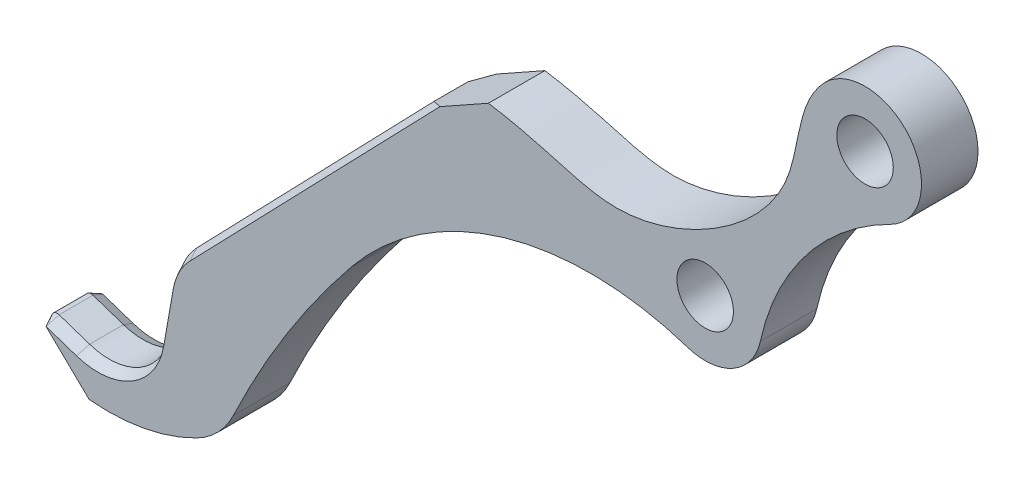
from build123d import *
from OCP.BRepFilletAPI import BRepFilletAPI_MakeChamfer

# Parameters (mm, degrees)
SKETCH_1_R          = 2.5
EXTRUDE_1_DEPTH     = 2.5
SKETCH_2_OUTSIDE_W  = 116.118
SKETCH_2_OUTSIDE_H  = 88.955
CUT_EXTRUDE_1_DEPTH = 5
CHAMFER_1_SIZE      = 1
CHAMFER_1_SIZE_2    = 0.5
CHAMFER_2_SIZE      = 0.5
CHAMFER_2_SIZE_2    = 1


with BuildPart() as part:
    # 草圖1 → 填料-伸長1 (new, symmetric)
    with BuildSketch(Plane.XY):
        with BuildLine():
            Line((33.210571119, 22.487406669), (9.212656684, 9.024071248))
            Line((9.212656684, 9.024071248), (9.212656684, 13.217540535))
            Line((9.212656684, 13.217540535), (-51.018500429, 13.217540535))
            Line((-51.018500429, 13.217540535), (-51.018500429, -41.386180002))
            Line((-51.018500429, -41.386180002), (9.212656684, -41.386180002))
            Line((9.212656684, -41.386180002), (9.212656684, -5))
            Line((9.212656684, -5), (21.5, -5))
            ThreePointArc((21.5, -5), (23.692257033, -4.493774483), (25.440603486, -3.07760364))
            Line((25.440603486, -3.07760364), (39.59758023, 15.049172396))
            ThreePointArc((39.59758023, 15.049172396), (39.450390654, 21.384077206), (33.210571119, 22.487406669))
        make_face()
        with Locations((21.5, 0)):
            Circle(SKETCH_1_R, mode=Mode.SUBTRACT)
        with Locations((35.656976744, 18.126776036)):
            Circle(SKETCH_1_R, mode=Mode.SUBTRACT)
    extrude(amount=EXTRUDE_1_DEPTH, both=True)

    # 草圖2 outside → 除料-伸長1 (cut)
    with BuildSketch(Plane.XY.offset(2.5)):
        with Locations((-5.181, -9.1295)):
            Rectangle(SKETCH_2_OUTSIDE_W, SKETCH_2_OUTSIDE_H)
        with BuildLine():
            Line((-3.504662874, 1.889387135), (-24.499095951, -19.837093245))
            ThreePointArc((-24.499095951, -19.837093245), (-25.530846828, -21.28330144), (-26.093887373, -22.968238639))
            Line((-26.093887373, -22.968238639), (-26.940110928, -27.785073774))
            ThreePointArc((-26.940110928, -27.785073774), (-29.508767127, -31.506192899), (-34.004940633, -31.984884889))
            Line((-34.004940633, -31.984884889), (-36.707285896, -31.076719678))
            ThreePointArc((-36.707285896, -31.076719678), (-37.293807717, -31.290934133), (-37.214008802, -31.910230356))
            Line((-37.214008802, -31.910230356), (-33.875603228, -35.136152419))
            ThreePointArc((-33.875603228, -35.136152419), (-28.5650672, -35.094081272), (-23.520676583, -33.433453021))
            ThreePointArc((-23.520676583, -33.433453021), (-21.623015625, -32.029319154), (-20.278640263, -30.088864592))
            ThreePointArc((-20.278640263, -30.088864592), (-15.559314436, -21.479893225), (-9.851228903, -13.492141112))
            ThreePointArc((-9.851228903, -13.492141112), (3.673898096, -4.470950273), (19.929199503, -4.746850092))
            ThreePointArc((19.929199503, -4.746850092), (23.974199209, -4.344920975), (26.383894798, -1.071247685))
            ThreePointArc((26.383894798, -1.071247685), (30.458421446, 7.595163953), (37.879524863, 13.647905658))
            ThreePointArc((37.879524863, 13.647905658), (39.697047859, 21.072590929), (32.072223107, 21.612395258))
            add(Edge.make_bspline(
                [(32.072223107, 21.612395258), (29.619553058, 19.089968877), (30.529442098, 9.384107467), (14.497116464, 0.221014353), (7.895302384, 4.290965143), (2.303499892, 5.147888773)],
                knots=[0, 0, 0, 0, 0.241565864, 0.691252681, 1, 1, 1, 1], degree=3))
            Line((2.303499892, 5.147888773), (-3.504662874, 1.889387135))
        make_face(mode=Mode.SUBTRACT)
    extrude(amount=-CUT_EXTRUDE_1_DEPTH, mode=Mode.SUBTRACT)

    # 導角1
    chamfer_1_edges_1 = [part.edges().sort_by_distance(p)[0] for p in [
        (-35.544806015, -33.523191388, 2.5),
    ]]
    chamfer_1_side_1 = [part.faces().sort_by_distance(p)[0] for p in [
        (-35.544806015, -33.523191388, 2.49),
    ]]
    chamfer_1_edges_2 = [part.edges().sort_by_distance(p)[0] for p in [
        (-37.293807717, -31.290934133, 2.5),
    ]]
    chamfer_1_side_2 = [part.faces().sort_by_distance(p)[0] for p in [
        (-37.293807717, -31.290934133, 2.49),
    ]]
    chamfer_1_edges_3 = [part.edges().sort_by_distance(p)[0] for p in [
        (-35.356113265, -31.530802283, 2.5),
    ]]
    chamfer_1_side_3 = [part.faces().sort_by_distance(p)[0] for p in [
        (-35.356113265, -31.530802283, 2.49),
    ]]
    chamfer_1_edges_4 = [part.edges().sort_by_distance(p)[0] for p in [
        (-29.508767127, -31.506192899, 2.5),
    ]]
    chamfer_1_side_4 = [part.faces().sort_by_distance(p)[0] for p in [
        (-29.508767127, -31.506192899, 2.49),
    ]]
    chamfer_1_edges_5 = [part.edges().sort_by_distance(p)[0] for p in [
        (-26.516999151, -25.376656206, 2.5),
    ]]
    chamfer_1_side_5 = [part.faces().sort_by_distance(p)[0] for p in [
        (-26.516999151, -25.376656206, 2.49),
    ]]
    chamfer_1_edges_6 = [part.edges().sort_by_distance(p)[0] for p in [
        (-25.530846828, -21.28330144, 2.5),
    ]]
    chamfer_1_side_6 = [part.faces().sort_by_distance(p)[0] for p in [
        (-25.530846828, -21.28330144, 2.49),
    ]]
    chamfer_1_edges_7 = [part.edges().sort_by_distance(p)[0] for p in [
        (-14.001879412, -8.973853055, 2.5),
    ]]
    chamfer_1_side_7 = [part.faces().sort_by_distance(p)[0] for p in [
        (-14.001879412, -8.973853055, 2.49),
    ]]
    chamfer_1 = BRepFilletAPI_MakeChamfer(part.part.solid().wrapped)
    for e in chamfer_1_edges_1:
        chamfer_1.Add(CHAMFER_1_SIZE - 0.0001, CHAMFER_1_SIZE_2 - 0.0001, e.wrapped, chamfer_1_side_1[0].wrapped)
    for e in chamfer_1_edges_2:
        chamfer_1.Add(CHAMFER_1_SIZE - 0.0001, CHAMFER_1_SIZE_2 - 0.0001, e.wrapped, chamfer_1_side_2[0].wrapped)
    for e in chamfer_1_edges_3:
        chamfer_1.Add(CHAMFER_1_SIZE - 0.0001, CHAMFER_1_SIZE_2 - 0.0001, e.wrapped, chamfer_1_side_3[0].wrapped)
    for e in chamfer_1_edges_4:
        chamfer_1.Add(CHAMFER_1_SIZE - 0.0001, CHAMFER_1_SIZE_2 - 0.0001, e.wrapped, chamfer_1_side_4[0].wrapped)
    for e in chamfer_1_edges_5:
        chamfer_1.Add(CHAMFER_1_SIZE - 0.0001, CHAMFER_1_SIZE_2 - 0.0001, e.wrapped, chamfer_1_side_5[0].wrapped)
    for e in chamfer_1_edges_6:
        chamfer_1.Add(CHAMFER_1_SIZE - 0.0001, CHAMFER_1_SIZE_2 - 0.0001, e.wrapped, chamfer_1_side_6[0].wrapped)
    for e in chamfer_1_edges_7:
        chamfer_1.Add(CHAMFER_1_SIZE - 0.0001, CHAMFER_1_SIZE_2 - 0.0001, e.wrapped, chamfer_1_side_7[0].wrapped)
    add(Compound.cast(chamfer_1.Shape()), mode=Mode.REPLACE)  # a hair under: the kernel refuses the full size

    # 導角2
    chamfer_2_edges_1 = [part.edges().sort_by_distance(p)[0] for p in [
        (-14.001879412, -8.973853055, -2.5),
    ]]
    chamfer_2_side_1 = [part.faces().sort_by_distance(p)[0] for p in [
        (-13.994688233, -8.980801936, -2.5),
    ]]
    chamfer_2_edges_2 = [part.edges().sort_by_distance(p)[0] for p in [
        (-25.530846828, -21.28330144, -2.5),
    ]]
    chamfer_2_side_2 = [part.faces().sort_by_distance(p)[0] for p in [
        (-25.521936065, -21.287839974, -2.5),
    ]]
    chamfer_2_edges_3 = [part.edges().sort_by_distance(p)[0] for p in [
        (-26.516999151, -25.376656206, -2.5),
    ]]
    chamfer_2_side_3 = [part.faces().sort_by_distance(p)[0] for p in [
        (-26.507149986, -25.378386512, -2.5),
    ]]
    chamfer_2_edges_4 = [part.edges().sort_by_distance(p)[0] for p in [
        (-29.508767127, -31.506192899, -2.5),
    ]]
    chamfer_2_side_4 = [part.faces().sort_by_distance(p)[0] for p in [
        (-29.503657181, -31.514788738, -2.5),
    ]]
    chamfer_2_edges_5 = [part.edges().sort_by_distance(p)[0] for p in [
        (-35.356113265, -31.530802283, -2.5),
    ]]
    chamfer_2_side_5 = [part.faces().sort_by_distance(p)[0] for p in [
        (-35.359298842, -31.540281318, -2.5),
    ]]
    chamfer_2_edges_6 = [part.edges().sort_by_distance(p)[0] for p in [
        (-37.293807717, -31.290934133, -2.5),
    ]]
    chamfer_2_side_6 = [part.faces().sort_by_distance(p)[0] for p in [
        (-37.285262858, -31.296128878, -2.5),
    ]]
    chamfer_2_edges_7 = [part.edges().sort_by_distance(p)[0] for p in [
        (-35.544806015, -33.523191388, -2.5),
    ]]
    chamfer_2_side_7 = [part.faces().sort_by_distance(p)[0] for p in [
        (-35.544806015, -33.523191388, -2.49),
    ]]
    chamfer_2 = BRepFilletAPI_MakeChamfer(part.part.solid().wrapped)
    for e in chamfer_2_edges_1:
        chamfer_2.Add(CHAMFER_2_SIZE - 0.0001, CHAMFER_2_SIZE_2 - 0.0001, e.wrapped, chamfer_2_side_1[0].wrapped)
    for e in chamfer_2_edges_2:
        chamfer_2.Add(CHAMFER_2_SIZE - 0.0001, CHAMFER_2_SIZE_2 - 0.0001, e.wrapped, chamfer_2_side_2[0].wrapped)
    for e in chamfer_2_edges_3:
        chamfer_2.Add(CHAMFER_2_SIZE - 0.0001, CHAMFER_2_SIZE_2 - 0.0001, e.wrapped, chamfer_2_side_3[0].wrapped)
    for e in chamfer_2_edges_4:
        chamfer_2.Add(CHAMFER_2_SIZE - 0.0001, CHAMFER_2_SIZE_2 - 0.0001, e.wrapped, chamfer_2_side_4[0].wrapped)
    for e in chamfer_2_edges_5:
        chamfer_2.Add(CHAMFER_2_SIZE - 0.0001, CHAMFER_2_SIZE_2 - 0.0001, e.wrapped, chamfer_2_side_5[0].wrapped)
    for e in chamfer_2_edges_6:
        chamfer_2.Add(CHAMFER_2_SIZE - 0.0001, CHAMFER_2_SIZE_2 - 0.0001, e.wrapped, chamfer_2_side_6[0].wrapped)
    for e in chamfer_2_edges_7:
        chamfer_2.Add(CHAMFER_2_SIZE_2 - 0.0001, CHAMFER_2_SIZE - 0.0001, e.wrapped, chamfer_2_side_7[0].wrapped)
    add(Compound.cast(chamfer_2.Shape()), mode=Mode.REPLACE)  # a hair under: the kernel refuses the full size


solid = part.part
